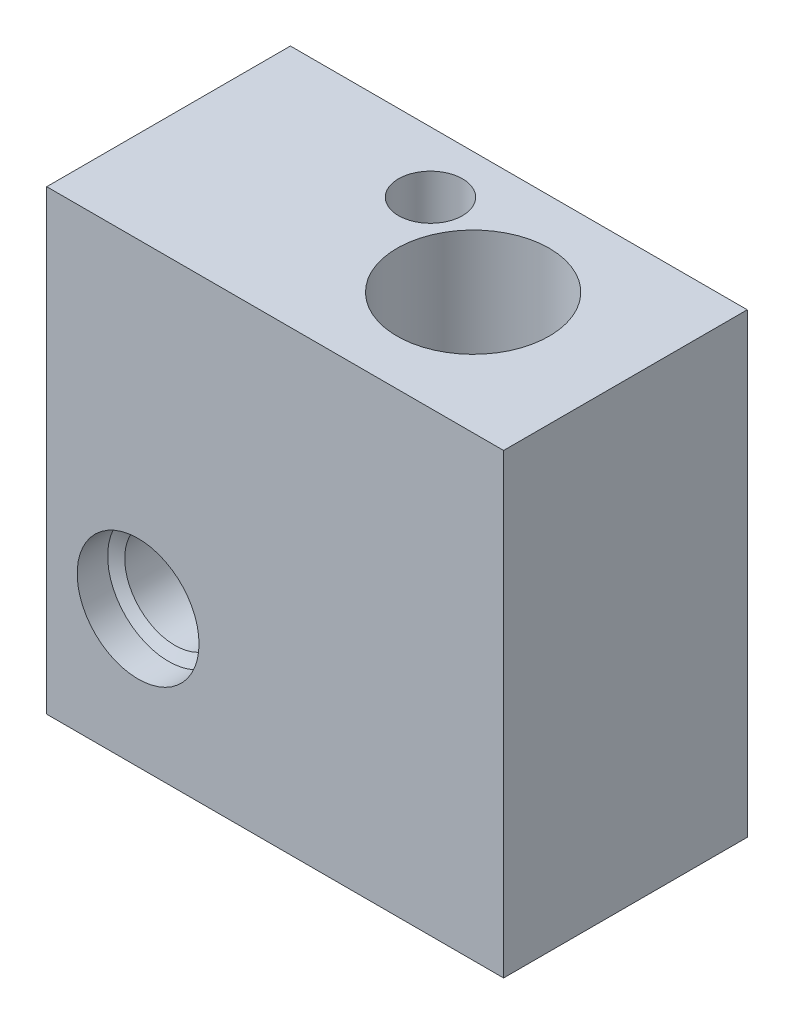
from build123d import *

# Parameters (mm, degrees)
SKETCH1_W                    = 15
SKETCH1_H                    = 15
SKETCH1_R                    = 1.65
BOSS_EXTRUDE1_DEPTH          = 8
SKETCH2_R                    = 2.5
CUT_EXTRUDE1_DEPTH           = 21.808652047
SKETCH3_R                    = 1.05
CUT_EXTRUDE2_DEPTH           = 21.808652047
F_4_0_4_DIAMETER_HOLE1_D     = 4
F_4_0_4_DIAMETER_HOLE1_DEPTH = 1
F_4_0_4_DIAMETER_HOLE1_TIP   = 1.201721238


with BuildPart() as part:
    # Sketch1 → Boss-Extrude1 (new body)
    with BuildSketch(Plane.XY):
        with Locations((4.5, 3)):
            Rectangle(SKETCH1_W, SKETCH1_H)
        Circle(SKETCH1_R, mode=Mode.SUBTRACT)
    extrude(amount=BOSS_EXTRUDE1_DEPTH)

    # Sketch2 → Cut-Extrude1 (cut, through all)
    with BuildSketch(Plane.XZ.offset(4.5)):
        with Locations((7, 4)):
            Circle(SKETCH2_R)
    extrude(amount=-CUT_EXTRUDE1_DEPTH, mode=Mode.SUBTRACT)

    # Sketch3 → Cut-Extrude2 (cut, through all)
    with BuildSketch(Plane.XZ.offset(4.5)):
        with Locations((3.6, 2)):
            Circle(SKETCH3_R)
    extrude(amount=-CUT_EXTRUDE2_DEPTH, mode=Mode.SUBTRACT)

    # Ø4.0 (4) Diameter Hole1
    with Locations(Plane.XY.offset(8)):
        with Locations((0, 0)):
            Hole(F_4_0_4_DIAMETER_HOLE1_D / 2, depth=F_4_0_4_DIAMETER_HOLE1_DEPTH)
            with Locations((0, 0, -(F_4_0_4_DIAMETER_HOLE1_DEPTH + F_4_0_4_DIAMETER_HOLE1_TIP / 2))):  # 118° drill point
                Cone(0, F_4_0_4_DIAMETER_HOLE1_D / 2, F_4_0_4_DIAMETER_HOLE1_TIP, mode=Mode.SUBTRACT)


solid = part.part
